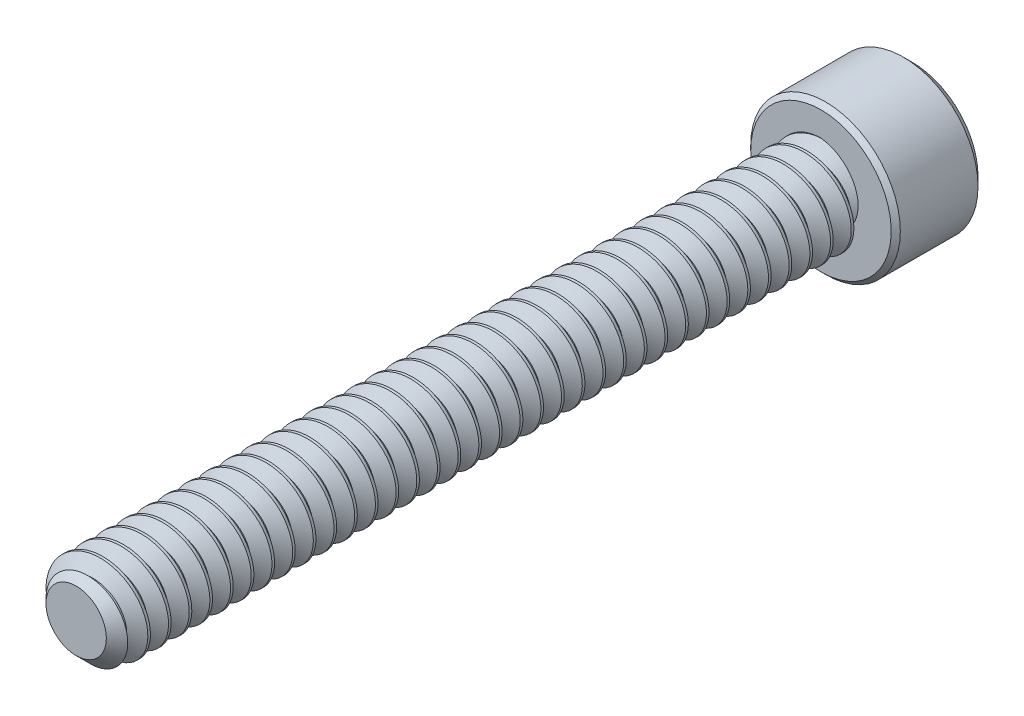
from build123d import *

# Parameters (mm, degrees)
SKETCH1_R          = 1.7526
EXTRUDE1_DEPTH     = 28.575
CHAMFER3_SIZE      = 0.5953125
CUT_SWEEP1_PITCH   = 0.79375
SKETCH6_R          = 2.8702
EXTRUDE2_DEPTH     = 3.5052
CUT_EXTRUDE1_DEPTH = 2.08359375
SKETCH8_R          = 1.603951217
CUT_EXTRUDE2_DEPTH = 0.35052
CUT_EXTRUDE2_DRAFT = -45
CHAMFER1_SIZE      = 0.35052
CHAMFER2_SIZE      = 0.17526


with BuildPart() as part:
    # Sketch1 → Extrude1 (new body)
    with BuildSketch(Plane.XY):
        Circle(SKETCH1_R)
    extrude(amount=-EXTRUDE1_DEPTH)

    # Chamfer3
    chamfer3_edges = [part.edges().sort_by_distance(p)[0] for p in [
        (-1.7526, 0, 0),
    ]]
    chamfer(chamfer3_edges, length=CHAMFER3_SIZE)

    # Cut-Sweep1: arcs per turn and ends read off the stored shape
    # Cut-Sweep1: the profile of Sketch3 profile screwed along a right-hand helix through 38 turns, 6 arcs to a turn; built about Z, then put on its axis
    cut_sweep1_z = Axis((0, 0, 0), (0, 0, 1))
    cut_sweep1_corners = [(1.7529, 0, -0.694704455), (1.237044252, 0, -0.396875), (1.237044252, 0, -0.29765625), (1.7529, 0, 0.000173205)]
    with BuildLine(mode=Mode.PRIVATE) as cut_sweep1_profile:
        Line(cut_sweep1_corners[0], cut_sweep1_corners[1])
        Line(cut_sweep1_corners[1], cut_sweep1_corners[2])
        Line(cut_sweep1_corners[2], cut_sweep1_corners[3])
        Line(cut_sweep1_corners[3], cut_sweep1_corners[0])
    cut_sweep1_cap = Face(cut_sweep1_profile.wire())
    cut_sweep1_turn_angles = [0, 30, 60, 90, 120, 150, 180, 210, 240, 270, 300, 330, 360]
    cut_sweep1_turn_weights = [1, 0.8660254037844387, 1, 0.8660254037844387, 1, 0.8660254037844387, 1, 0.8660254037844387, 1, 0.8660254037844387, 1, 0.8660254037844387, 1]
    cut_sweep1_turn_rails = [Edge.make_bspline([Vector(p[0], p[1], 0).rotate(cut_sweep1_z, cut_sweep1_turn_angles[k]) / cut_sweep1_turn_weights[k] + Vector(0, 0, p[2] + CUT_SWEEP1_PITCH * cut_sweep1_turn_angles[k] / 360) for k in range(13)], [0, 0, 0, 1, 1, 2, 2, 3, 3, 4, 4, 5, 5, 6, 6, 6], 2, cut_sweep1_turn_weights) for p in cut_sweep1_corners]
    cut_sweep1_turn_sides = [Face.make_surface_from_curves(cut_sweep1_turn_rails[p[0]], cut_sweep1_turn_rails[p[1]]) for p in [(0, 1), (1, 2), (2, 3), (3, 0)]]
    cut_sweep1 = Plane(origin=(0, 0, 0), x_dir=(0, 1, 0), z_dir=(0, 0, -1)) * Solid(Shell([*[p.moved(Location((0, 0, CUT_SWEEP1_PITCH * i))) for i in range(38) for p in cut_sweep1_turn_sides], cut_sweep1_cap, cut_sweep1_cap.rotate(cut_sweep1_z, 13680).moved(Location((0, 0, CUT_SWEEP1_PITCH * 13680 / 360)))]))
    add(cut_sweep1, mode=Mode.SUBTRACT)

    # Sketch6 → Extrude2 (add)
    with BuildSketch(Plane(origin=(0, 0, -28.575), x_dir=(-1, 0, 0), z_dir=(0, 0, -1))):
        Circle(SKETCH6_R)
    extrude(amount=EXTRUDE2_DEPTH)

    # Sketch7 → Cut-Extrude1 (cut)
    with BuildSketch(Plane(origin=(0, 0, -32.0802), x_dir=(-1, 0, 0), z_dir=(0, 0, -1))):
        Polygon((0, 1.603951217), (-1.3890625, 0.801975608), (-1.3890625, -0.801975608), (0, -1.603951217), (1.3890625, -0.801975608), (1.3890625, 0.801975608), align=None)
    extrude(amount=-CUT_EXTRUDE1_DEPTH, mode=Mode.SUBTRACT)


with BuildPart() as cut_extrude2_tool:
    # Sketch8 → Cut-Extrude2 (with draft: the straight prism first)
    with BuildSketch(Plane(origin=(0, 0, -32.0802), x_dir=(-1, 0, 0), z_dir=(0, 0, -1))):
        Circle(SKETCH8_R)
    extrude(amount=-CUT_EXTRUDE2_DEPTH)
    # Cut-Extrude2: the draft: its side faces are tilted about the plane it starts from
    cut_extrude2_sides = [cut_extrude2_tool.faces().sort_by_distance(p)[0] for p in [
        (1.603951217, 0, -31.90494),
    ]]
    draft(cut_extrude2_sides, Plane(origin=(0, 0, -32.0802), x_dir=(-1, 0, 0), z_dir=(0, 0, -1)), CUT_EXTRUDE2_DRAFT)


with BuildPart() as part_1:
    add(part.part)

    # Cut-Extrude2: cut by cut_extrude2_tool
    add(cut_extrude2_tool.part, mode=Mode.SUBTRACT)

    # Chamfer1
    chamfer1_edges = [part_1.edges().sort_by_distance(p)[0] for p in [
        (2.8702, 0, -32.0802),
    ]]
    chamfer(chamfer1_edges, length=CHAMFER1_SIZE)

    # Chamfer2
    chamfer2_edges = [part_1.edges().sort_by_distance(p)[0] for p in [
        (2.8702, 0, -28.575),
    ]]
    chamfer(chamfer2_edges, length=CHAMFER2_SIZE)


solid = part_1.part
